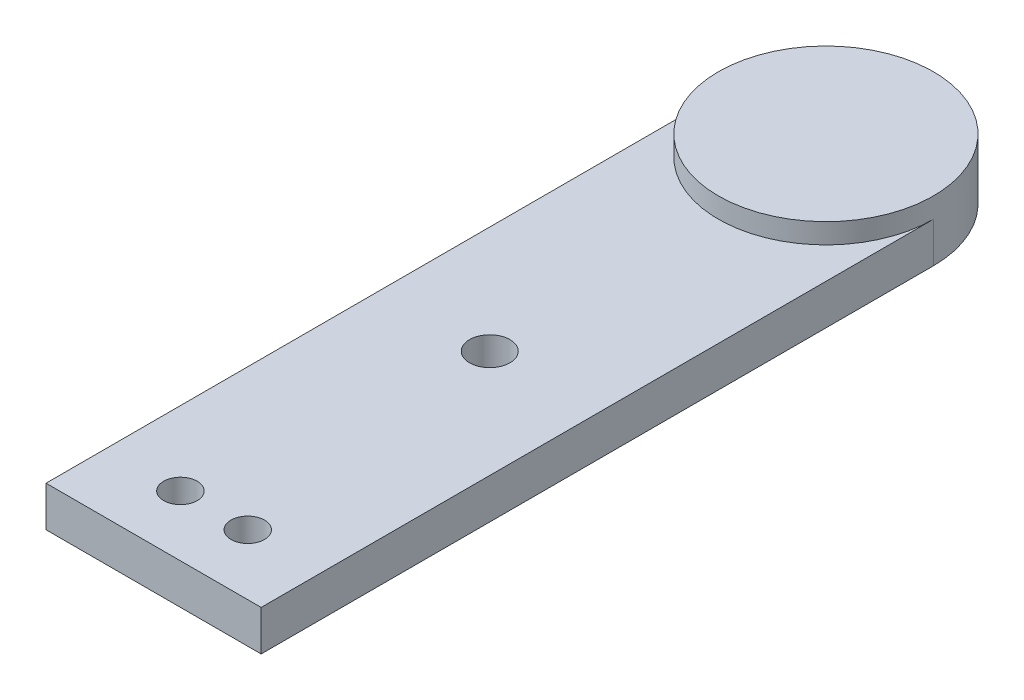
from build123d import *

# Parameters (mm, degrees)
BOSS_EXTRUDE1_DEPTH      = 3
BOSS_EXTRUDE1_DEPTH_BACK = 1.5
SKETCH1_R                = 8
SKETCH2_W                = 16
SKETCH2_H                = 50
BOSS_EXTRUDE2_DEPTH      = 1.5
CUT_EXTRUDE1_REACH       = 52.836
SKETCH3_R                = 1.25
CUT_EXTRUDE3_REACH       = 52.725
SKETCH5_R                = 1.5


with BuildPart() as part:
    # Sketch1 → Boss-Extrude1 (new, two sides: drawn at the far end of the back side and taken through both)
    with BuildSketch(Plane(origin=(0, 0, 0), x_dir=(1, 0, 0), z_dir=(0, 1, 0)).offset(-BOSS_EXTRUDE1_DEPTH_BACK)):
        Circle(SKETCH1_R)
    extrude(amount=BOSS_EXTRUDE1_DEPTH + BOSS_EXTRUDE1_DEPTH_BACK)

    # Sketch2 → Boss-Extrude2 (add, symmetric)
    with BuildSketch(Plane(origin=(0, 0, 0), x_dir=(1, 0, 0), z_dir=(0, 1, 0))):
        with Locations((0, -25)):
            Rectangle(SKETCH2_W, SKETCH2_H)
    extrude(amount=BOSS_EXTRUDE2_DEPTH, both=True)

    # Sketch3 → Cut-Extrude1 (cut, up to next)
    with BuildSketch(Plane(origin=(0, -1.5, 0), x_dir=(-1, 0, 0), z_dir=(0, -1, 0)), mode=Mode.PRIVATE) as cut_extrude1_sk1:
        with Locations((2.503073418, -45.5)):
            Circle(SKETCH3_R)
    cut_extrude1_tool1 = extrude(cut_extrude1_sk1.sketch, amount=-CUT_EXTRUDE1_REACH, mode=Mode.PRIVATE) & part.part
    # Sketch3 → Cut-Extrude1 (cut, up to next)
    with BuildSketch(Plane(origin=(0, -1.5, 0), x_dir=(-1, 0, 0), z_dir=(0, -1, 0)), mode=Mode.PRIVATE) as cut_extrude1_sk2:
        with Locations((-2.503073418, -45.5)):
            Circle(SKETCH3_R)
    cut_extrude1_tool2 = extrude(cut_extrude1_sk2.sketch, amount=-CUT_EXTRUDE1_REACH, mode=Mode.PRIVATE) & part.part
    add(cut_extrude1_tool1.solids().sort_by_distance((-2.503073, -1.5, 45.5))[0], mode=Mode.SUBTRACT)
    add(cut_extrude1_tool2.solids().sort_by_distance((2.503073, -1.5, 45.5))[0], mode=Mode.SUBTRACT)

    # Sketch4 → Cut-Revolve21 (revolve, cut)
    with BuildSketch(Plane(origin=(0, -1.5, 0), x_dir=(-1, 0, 0), z_dir=(0, -1, 0))):
        with BuildLine():
            Line((3.3, 0), (-3.3, 0))
            ThreePointArc((-3.3, 0), (0, -3.3), (3.3, 0))
        make_face()
    revolve(axis=Axis((3.3, -1.5, 0), (-1, 0, 0)), mode=Mode.SUBTRACT)

    # Sketch5 → Cut-Extrude3 (cut, up to next)
    with BuildSketch(Plane(origin=(0, 1.5, 0), x_dir=(1, 0, 0), z_dir=(0, 1, 0)), mode=Mode.PRIVATE) as cut_extrude3_sk1:
        with Locations((0, -25)):
            Circle(SKETCH5_R)
    cut_extrude3_tool1 = extrude(cut_extrude3_sk1.sketch, amount=-CUT_EXTRUDE3_REACH, mode=Mode.PRIVATE) & part.part
    add(cut_extrude3_tool1.solids().sort_by_distance((0, 1.5, 25))[0], mode=Mode.SUBTRACT)


solid = part.part
